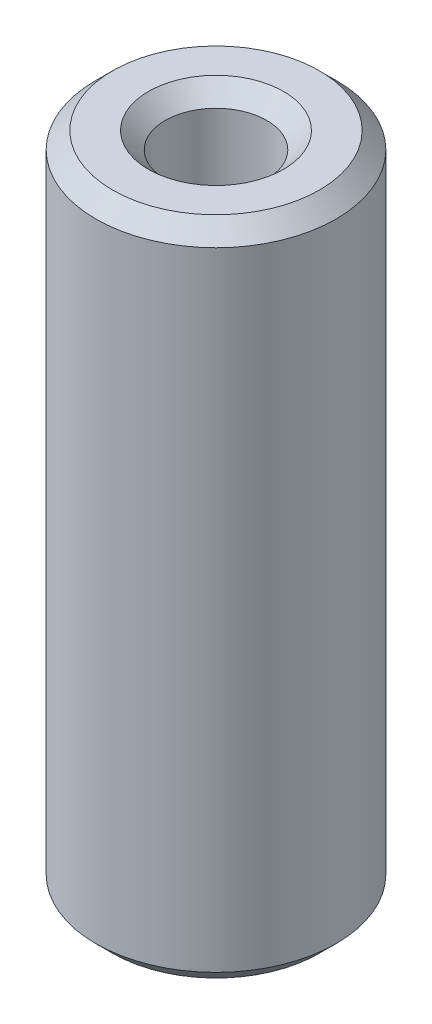
from build123d import *

# Parameters (mm, degrees)
SKETCH1_R           = 27.5
BOSS_EXTRUDE1_DEPTH = 151.349249279
SKETCH2_R           = 11.631327245
CUT_EXTRUDE1_DEPTH  = 157.266103993
CHAMFER1_SIZE       = 3.830717783


with BuildPart() as part:
    # Sketch1 → Boss-Extrude1 (new body)
    with BuildSketch(Plane(origin=(0, 0, 0), x_dir=(1, 0, 0), z_dir=(0, 1, 0))):
        Circle(SKETCH1_R)
    extrude(amount=BOSS_EXTRUDE1_DEPTH)

    # Sketch2 → Cut-Extrude1 (cut, through all)
    with BuildSketch(Plane(origin=(0, 0, 0), x_dir=(1, 0, 0), z_dir=(0, 1, 0))):
        Circle(SKETCH2_R)
    extrude(amount=CUT_EXTRUDE1_DEPTH, mode=Mode.SUBTRACT)

    # Chamfer1
    chamfer1_edges = [part.edges().sort_by_distance(p)[0] for p in [
        (-11.631327245, 151.349249279, 0),
        (-11.631327245, 0, 0),
        (-27.5, 0, 0),
        (-27.5, 151.349249279, 0),
    ]]
    chamfer(chamfer1_edges, length=CHAMFER1_SIZE)


solid = part.part
